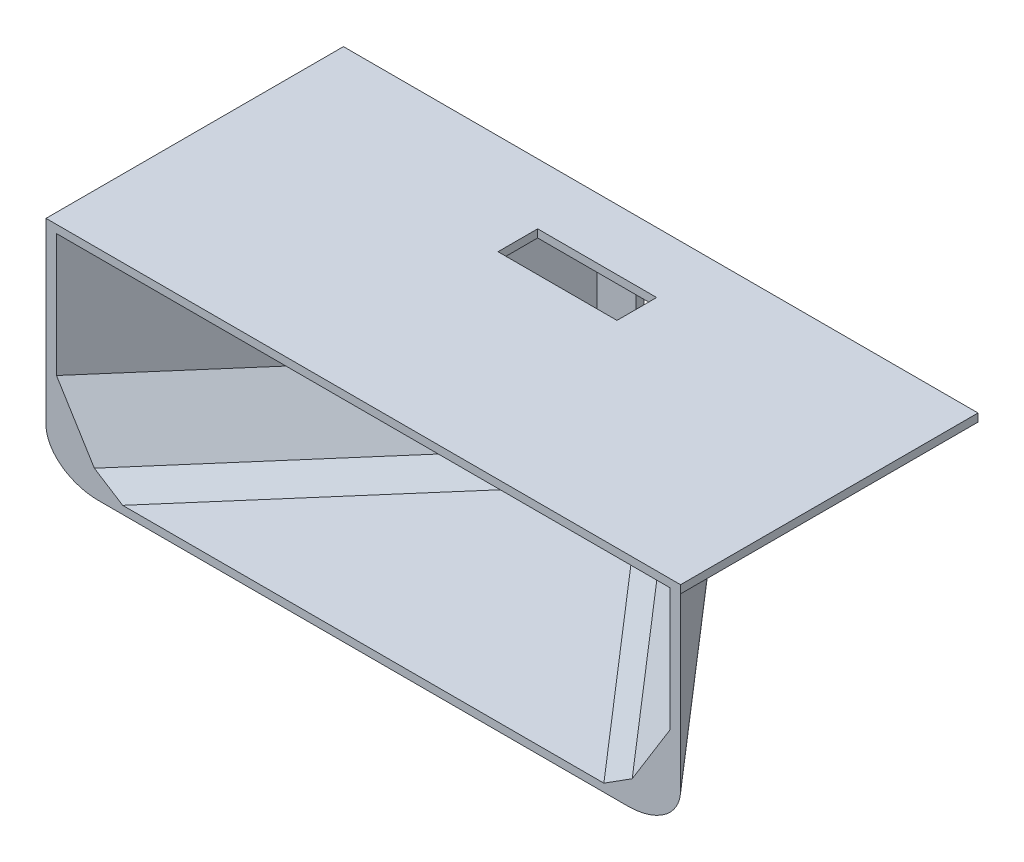
from build123d import *
from OCP.BRepFilletAPI import BRepFilletAPI_MakeChamfer

# Parameters (mm, degrees)
BOSS_EXTRUDE1_DEPTH = 55
SHELL1_T            = -2
SKETCH6_W           = 30
SKETCH6_H           = 10.709947061
CUT_EXTRUDE3_DEPTH  = 4
SKETCH5_W           = 8.5
SKETCH5_H           = 8.497801987
CUT_EXTRUDE5_DEPTH  = 6
SKETCH10_W          = 160
SKETCH10_H          = 2
BOSS_EXTRUDE2_DEPTH = 75
SKETCH11_W          = 30
SKETCH11_H          = 10
CUT_EXTRUDE6_DEPTH  = 8
CHAMFER3_SIZE       = 20
CHAMFER3_SIZE2      = 9.326153163
CHAMFER4_SIZE       = 15
CHAMFER4_SIZE2      = 8.660254038
CHAMFER5_SIZE       = 20
CHAMFER5_SIZE2      = 9.326153163
CHAMFER9_SIZE       = 5
CHAMFER9_SIZE2      = 3.287386497
FILLET1_R           = 10
FILLET2_R           = 10


with BuildPart() as part:
    # Sketch1 → Boss-Extrude1 (new body)
    with BuildSketch(Plane(origin=(0, 0, 0), x_dir=(1, 0, 0), z_dir=(0, 1, 0))):
        Polygon((0, 0), (-160, 0), (-94.996692416, 75), (-64.996692416, 75), align=None)
    extrude(amount=-BOSS_EXTRUDE1_DEPTH)

    # Shell1
    shell1_openings = [part.faces().sort_by_distance(p)[0] for p in [
        (-80, -27.5, 0),
    ]]
    offset(amount=SHELL1_T, openings=shell1_openings, kind=Kind.INTERSECTION)

    # Sketch6 → Cut-Extrude3 (cut)
    with BuildSketch(Plane(origin=(0, 0, 0), x_dir=(1, 0, 0), z_dir=(0, 1, 0))):
        with Locations((-80.447039031, 51.579276021)):
            Rectangle(SKETCH6_W, SKETCH6_H)
    extrude(amount=-CUT_EXTRUDE3_DEPTH, mode=Mode.SUBTRACT)

    # Sketch5 → Cut-Extrude5 (cut)
    with BuildSketch(Plane.XY.offset(-73)):
        with Locations((-79.998465085, -16.748900994)):
            Rectangle(SKETCH5_W, SKETCH5_H)
    extrude(amount=-CUT_EXTRUDE5_DEPTH, mode=Mode.SUBTRACT)

    # Sketch10 → Boss-Extrude2 (add)
    with BuildSketch(Plane.XY):
        with Locations((-80, -1)):
            Rectangle(SKETCH10_W, SKETCH10_H)
    extrude(amount=-BOSS_EXTRUDE2_DEPTH)

    # Sketch11 → Cut-Extrude6 (cut)
    with BuildSketch(Plane(origin=(0, -2, 0), x_dir=(-1, 0, 0), z_dir=(0, -1, 0))):
        with Locations((80.729529252, 54.69995574)):
            Rectangle(SKETCH11_W, SKETCH11_H)
    extrude(amount=-CUT_EXTRUDE6_DEPTH, mode=Mode.SUBTRACT)

    # Chamfer3: one chamfer whose edges measure the first distance from different faces: ONE call of the kernel's chamfer builder (chamfer() names one face for all edges)
    chamfer3_edges_1 = [part.edges().sort_by_distance(p)[0] for p in [
        (-125.71840811, -53, -36.5),
    ]]
    chamfer3_side_1 = [part.faces().sort_by_distance(p)[0] for p in [
        (-125.71840811, -27.5, -36.5),
    ]]
    chamfer3_edges_2 = [part.edges().sort_by_distance(p)[0] for p in [
        (-34.278256976, -53, -36.5),
    ]]
    chamfer3_side_2 = [part.faces().sort_by_distance(p)[0] for p in [
        (-34.278256976, -27.5, -36.5),
    ]]
    chamfer3 = BRepFilletAPI_MakeChamfer(part.part.solid().wrapped)
    for e in chamfer3_edges_1:
        chamfer3.Add(CHAMFER3_SIZE, CHAMFER3_SIZE2, e.wrapped, chamfer3_side_1[0].wrapped)  # the first distance lies on this face
    for e in chamfer3_edges_2:
        chamfer3.Add(CHAMFER3_SIZE, CHAMFER3_SIZE2, e.wrapped, chamfer3_side_2[0].wrapped)  # the first distance lies on this face
    add(Compound.cast(chamfer3.Shape()), mode=Mode.REPLACE)

    # Chamfer4
    chamfer4_edges = [part.edges().sort_by_distance(p)[0] for p in [
        (-79.996692416, -55, -75),
    ]]
    chamfer4_side = [part.faces().sort_by_distance(p)[0] for p in [
        (-79.998723389, -55, -28.947368421),
    ]]
    chamfer(chamfer4_edges, length=CHAMFER4_SIZE, length2=CHAMFER4_SIZE2, reference=chamfer4_side[0])

    # Chamfer5
    chamfer5_edges = [part.edges().sort_by_distance(p)[0] for p in [
        (-79.996453483, -53, -73),
    ]]
    chamfer5_side = [part.faces().sort_by_distance(p)[0] for p in [
        (-79.99658203, -24.03604903, -73),
    ]]
    chamfer(chamfer5_edges, length=CHAMFER5_SIZE, length2=CHAMFER5_SIZE2, reference=chamfer5_side[0])

    # Chamfer9: one chamfer whose edges measure the first distance from different faces: ONE call of the kernel's chamfer builder (chamfer() names one face for all edges)
    chamfer9_edges_1 = [part.edges().sort_by_distance(p)[0] for p in [
        (-117.418420447, -53, -31.836923418),
    ]]
    chamfer9_side_1 = [part.faces().sort_by_distance(p)[0] for p in [
        (-121.662808046, -42.7725448, -34.22149376),
    ]]
    chamfer9_edges_2 = [part.edges().sort_by_distance(p)[0] for p in [
        (-79.996864777, -53, -63.673846837),
    ]]
    chamfer9_side_2 = [part.faces().sort_by_distance(p)[0] for p in [
        (-79.996789602, -42.406424161, -68.613712378),
    ]]
    chamfer9_edges_3 = [part.edges().sort_by_distance(p)[0] for p in [
        (-42.578117194, -53, -31.836923418),
    ]]
    chamfer9_side_3 = [part.faces().sort_by_distance(p)[0] for p in [
        (-38.333794767, -42.7725448, -34.22149376),
    ]]
    chamfer9 = BRepFilletAPI_MakeChamfer(part.part.solid().wrapped)
    for e in chamfer9_edges_1:
        chamfer9.Add(CHAMFER9_SIZE, CHAMFER9_SIZE2, e.wrapped, chamfer9_side_1[0].wrapped)  # the first distance lies on this face
    for e in chamfer9_edges_2:
        chamfer9.Add(CHAMFER9_SIZE, CHAMFER9_SIZE2, e.wrapped, chamfer9_side_2[0].wrapped)  # the first distance lies on this face
    for e in chamfer9_edges_3:
        chamfer9.Add(CHAMFER9_SIZE, CHAMFER9_SIZE2, e.wrapped, chamfer9_side_3[0].wrapped)  # the first distance lies on this face
    add(Compound.cast(chamfer9.Shape()), mode=Mode.REPLACE)

    # Fillet1
    fillet1_edges = [part.edges().sort_by_distance(p)[0] for p in [
        (-25.998676966, -55, -30),
        (-133.998676966, -55, -30),
    ]]
    fillet(fillet1_edges, radius=FILLET1_R)

    # Fillet2
    fillet2_edges = [part.edges().sort_by_distance(p)[0] for p in [
        (-79.996689812, -46.339745962, -75),
    ]]
    fillet(fillet2_edges, radius=FILLET2_R)


solid = part.part
